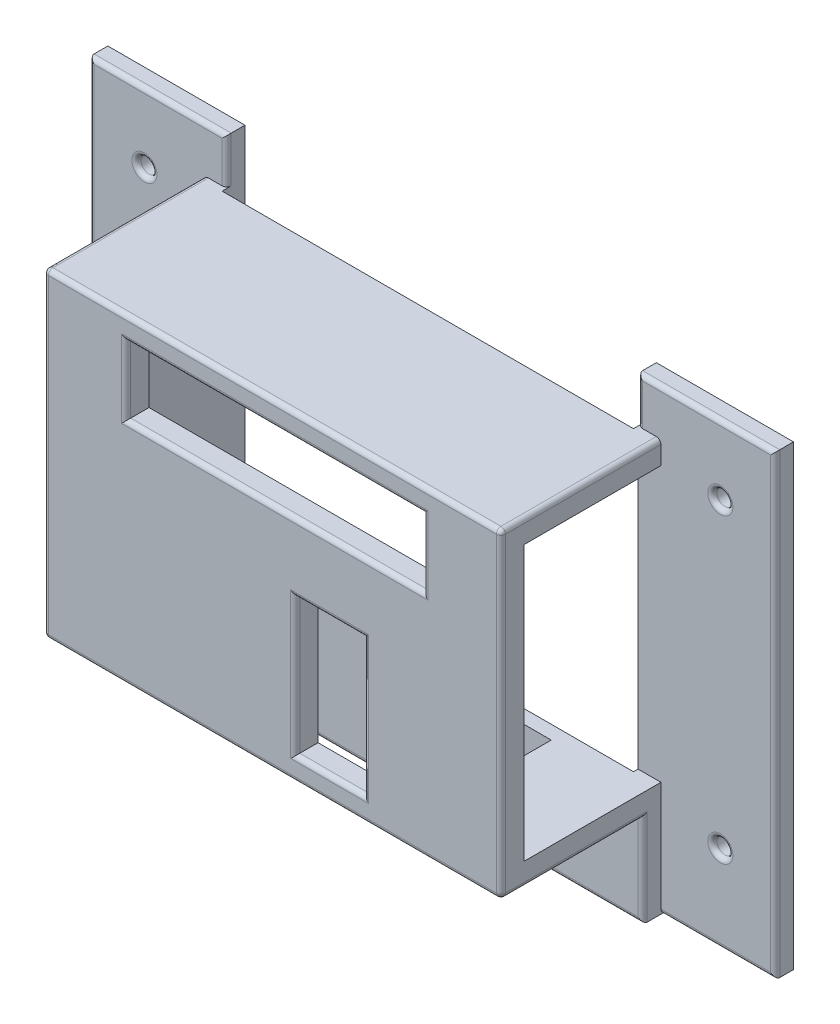
from build123d import *

# Parameters (mm, degrees)
SKETCH1_W           = 150
SKETCH1_H           = 100
BOSS_EXTRUDE1_DEPTH = 4
SKETCH2_W           = 100
SKETCH2_H           = 100
BOSS_EXTRUDE2_DEPTH = 35
SKETCH3_W           = 100
SKETCH3_H           = 31
CUT_EXTRUDE1_DEPTH  = 20
SKETCH4_W           = 100
SKETCH4_H           = 35
CUT_EXTRUDE2_DEPTH  = 10
SKETCH5_W           = 30
SKETCH5_H           = 60
CUT_EXTRUDE3_DEPTH  = 95
SKETCH6_W           = 90
SKETCH6_H           = 5
CUT_EXTRUDE4_DEPTH  = 185.447824601
SKETCH7_W           = 75
SKETCH7_H           = 26
CUT_EXTRUDE5_DEPTH  = 5
SKETCH8_W           = 65
SKETCH8_H           = 15
CUT_EXTRUDE6_DEPTH  = 5
SKETCH9_W           = 15
SKETCH9_H           = 30
CUT_EXTRUDE7_DEPTH  = 5
SKETCH10_R          = 1.75
CUT_EXTRUDE8_DEPTH  = 5
FILLET1_R           = 1
FILLET2_R           = 1
FILLET3_R           = 1
FILLET4_R           = 1
FILLET5_R           = 1


with BuildPart() as part:
    # Sketch1 → Boss-Extrude1 (new body)
    with BuildSketch(Plane.XY):
        with Locations((75, 50)):
            Rectangle(SKETCH1_W, SKETCH1_H)
    extrude(amount=BOSS_EXTRUDE1_DEPTH)

    # Sketch2 → Boss-Extrude2 (add)
    with BuildSketch(Plane.XY.offset(4)):
        with Locations((75, 50)):
            Rectangle(SKETCH2_W, SKETCH2_H)
    extrude(amount=BOSS_EXTRUDE2_DEPTH)

    # Sketch3 → Cut-Extrude1 (cut)
    with BuildSketch(Plane(origin=(0, 0, 0), x_dir=(-1, 0, 0), z_dir=(0, -1, 0))):
        with Locations((-75, -23.5)):
            Rectangle(SKETCH3_W, SKETCH3_H)
    extrude(amount=-CUT_EXTRUDE1_DEPTH, mode=Mode.SUBTRACT)

    # Sketch4 → Cut-Extrude2 (cut)
    with BuildSketch(Plane(origin=(0, 100, 0), x_dir=(1, 0, 0), z_dir=(0, 1, 0))):
        with Locations((75, -21.5)):
            Rectangle(SKETCH4_W, SKETCH4_H)
    extrude(amount=-CUT_EXTRUDE2_DEPTH, mode=Mode.SUBTRACT)

    # Sketch5 → Cut-Extrude3 (cut)
    with BuildSketch(Plane(origin=(125, 0, 0), x_dir=(0, 0, -1), z_dir=(1, 0, 0))):
        with Locations((-19, 55)):
            Rectangle(SKETCH5_W, SKETCH5_H)
    extrude(amount=-CUT_EXTRUDE3_DEPTH, mode=Mode.SUBTRACT)

    # Sketch6 → Cut-Extrude4 (cut, through all)
    with BuildSketch(Plane(origin=(0, 0, 0), x_dir=(-1, 0, 0), z_dir=(0, -1, 0))):
        with Locations((-75, -2.5)):
            Rectangle(SKETCH6_W, SKETCH6_H)
    extrude(amount=-CUT_EXTRUDE4_DEPTH, mode=Mode.SUBTRACT)

    # Sketch7 → Cut-Extrude5 (cut)
    with BuildSketch(Plane(origin=(0, 20, 0), x_dir=(-1, 0, 0), z_dir=(0, -1, 0))):
        with Locations((-67.5, -21)):
            Rectangle(SKETCH7_W, SKETCH7_H)
    extrude(amount=-CUT_EXTRUDE5_DEPTH, mode=Mode.SUBTRACT)

    # Sketch8 → Cut-Extrude6 (cut)
    with BuildSketch(Plane.XY.offset(39)):
        with Locations((75.5, 77.5)):
            Rectangle(SKETCH8_W, SKETCH8_H)
    extrude(amount=-CUT_EXTRUDE6_DEPTH, mode=Mode.SUBTRACT)

    # Sketch9 → Cut-Extrude7 (cut)
    with BuildSketch(Plane.XY.offset(39)):
        with Locations((87.5, 40)):
            Rectangle(SKETCH9_W, SKETCH9_H)
    extrude(amount=-CUT_EXTRUDE7_DEPTH, mode=Mode.SUBTRACT)

    # Sketch10 → Cut-Extrude8 (cut)
    with BuildSketch(Plane.XY.offset(4)):
        with Locations((12, 85)):
            Circle(SKETCH10_R)
        with Locations((12, 19)):
            Circle(SKETCH10_R)
        with Locations((138, 85)):
            Circle(SKETCH10_R)
        with Locations((138, 19)):
            Circle(SKETCH10_R)
    extrude(amount=-CUT_EXTRUDE8_DEPTH, mode=Mode.SUBTRACT)

    # Fillet1
    fillet1_edges = [part.edges().sort_by_distance(p)[0] for p in [
        (10.25, 19, 4),
        (136.25, 85, 4),
        (136.25, 19, 4),
        (10.25, 85, 4),
    ]]
    fillet(fillet1_edges, radius=FILLET1_R)

    # Fillet2
    fillet2_edges = [part.edges().sort_by_distance(p)[0] for p in [
        (43, 77.5, 39),
        (75.5, 70, 39),
        (108, 77.5, 39),
        (75.5, 85, 39),
        (80, 40, 39),
        (87.5, 25, 39),
        (95, 40, 39),
        (87.5, 55, 39),
        (125, 55, 39),
        (75, 20, 39),
        (25, 55, 39),
        (75, 90, 39),
    ]]
    fillet(fillet2_edges, radius=FILLET2_R)

    # Fillet3
    # the kernel refuses this fillet: 1 mm, written as the material it takes off along each edge
    with BuildSketch(Plane(origin=(26, 21, 38), x_dir=(0, -1, 0), z_dir=(-1, 0, 0))) as fillet3_piece_1_section:
        Polygon((0, 0), (FILLET3_R, 0), (FILLET3_R, FILLET3_R), (0, FILLET3_R), align=None)
    fillet3_piece_1 = extrude(amount=FILLET3_R, mode=Mode.PRIVATE)
    fillet3_piece_1 = fillet3_piece_1 - Plane(origin=(26, 21, 38), x_dir=(0, 0.7071067811865475, -0.7071067811865475), z_dir=(-1, 0, 0)) * Sphere(FILLET3_R, mode=Mode.PRIVATE)
    add(fillet3_piece_1, mode=Mode.SUBTRACT)
    with BuildSketch(Plane(origin=(26, 89, 38), x_dir=(-1, 0, 0), z_dir=(0, 1, 0))) as fillet3_piece_2_section:
        Polygon((0, 0), (FILLET3_R, 0), (FILLET3_R, FILLET3_R), (0, FILLET3_R), align=None)
    fillet3_piece_2 = extrude(amount=FILLET3_R, mode=Mode.PRIVATE)
    fillet3_piece_2 = fillet3_piece_2 - Plane(origin=(26, 89, 38), x_dir=(0.7071067811865475, 0, -0.7071067811865475), z_dir=(0, 1, 0)) * Sphere(FILLET3_R, mode=Mode.PRIVATE)
    add(fillet3_piece_2, mode=Mode.SUBTRACT)
    with BuildSketch(Plane(origin=(124, 21, 38), x_dir=(0, -1, 0), z_dir=(1, 0, 0))) as fillet3_piece_3_section:
        Polygon((0, 0), (FILLET3_R, 0), (FILLET3_R, -FILLET3_R), (0, -FILLET3_R), align=None)
    fillet3_piece_3 = extrude(amount=FILLET3_R, mode=Mode.PRIVATE)
    fillet3_piece_3 = fillet3_piece_3 - Plane(origin=(124, 21, 38), x_dir=(0, 0.7071067811865475, -0.7071067811865475), z_dir=(1, 0, 0)) * Sphere(FILLET3_R, mode=Mode.PRIVATE)
    add(fillet3_piece_3, mode=Mode.SUBTRACT)
    with BuildSketch(Plane(origin=(124, 89, 38), x_dir=(1, 0, 0), z_dir=(0, 1, 0))) as fillet3_piece_4_section:
        Polygon((0, 0), (FILLET3_R, 0), (FILLET3_R, -FILLET3_R), (0, -FILLET3_R), align=None)
    fillet3_piece_4 = extrude(amount=FILLET3_R, mode=Mode.PRIVATE)
    fillet3_piece_4 = fillet3_piece_4 - Plane(origin=(124, 89, 38), x_dir=(-0.7071067811865475, 0, -0.7071067811865475), z_dir=(0, 1, 0)) * Sphere(FILLET3_R, mode=Mode.PRIVATE)
    add(fillet3_piece_4, mode=Mode.SUBTRACT)
    with BuildSketch(Plane(origin=(125, 90, 38), x_dir=(-1, 0, 0), z_dir=(0, 0, -1)), Plane(origin=(25, 90, 4), x_dir=(1, 0, 0), z_dir=(0, 0, 1))) as fillet3_piece_5:
        with BuildLine():
            CenterArc((FILLET3_R, -FILLET3_R), FILLET3_R, 90, 90)
            Line((0, -FILLET3_R), (0, 0))
            Line((0, 0), (FILLET3_R, 0))
        make_face()
    extrude(amount=34, mode=Mode.SUBTRACT)
    with BuildSketch(Plane(origin=(25, 20, 8), x_dir=(0, 1, 0), z_dir=(0, 0, 1)), Plane(origin=(125, 20, 38), x_dir=(0, 1, 0), z_dir=(0, 0, -1))) as fillet3_piece_6:
        with BuildLine():
            CenterArc((FILLET3_R, -FILLET3_R), FILLET3_R, 90, 90)
            Line((0, -FILLET3_R), (0, 0))
            Line((0, 0), (FILLET3_R, 0))
        make_face()
    extrude(amount=30, mode=Mode.SUBTRACT)
    with BuildSketch(Plane(origin=(25, -2.5, 8), x_dir=(0, 0, -1), z_dir=(0, 1, 0))) as fillet3_piece_7:
        with BuildLine():
            CenterArc((FILLET3_R, -FILLET3_R), FILLET3_R, 90, 90)
            Line((0, -FILLET3_R), (0, 0))
            Line((0, 0), (FILLET3_R, 0))
        make_face()
    extrude(amount=22.5, mode=Mode.SUBTRACT)
    with BuildSketch(Plane(origin=(125, -2.5, 8), x_dir=(0, 0, -1), z_dir=(0, 1, 0))) as fillet3_piece_8:
        with BuildLine():
            CenterArc((FILLET3_R, FILLET3_R), FILLET3_R, 180, 90)
            Line((0, FILLET3_R), (0, 0))
            Line((0, 0), (FILLET3_R, 0))
        make_face()
    extrude(amount=22.5, mode=Mode.SUBTRACT)
    with BuildSketch(Plane(origin=(127.5, 0, 8), x_dir=(0, 1, 0), z_dir=(-1, 0, 0))) as fillet3_piece_9:
        with BuildLine():
            CenterArc((FILLET3_R, FILLET3_R), FILLET3_R, 180, 90)
            Line((0, FILLET3_R), (0, 0))
            Line((0, 0), (FILLET3_R, 0))
        make_face()
    extrude(amount=105, mode=Mode.SUBTRACT)
    with BuildSketch(Plane(origin=(25, 20, 5.5), x_dir=(0, 1, 0), z_dir=(0, 0, 1))) as fillet3_piece_10a_section:
        with BuildLine():
            CenterArc((FILLET3_R, -FILLET3_R), FILLET3_R, 90, 90)
            Line((0, -FILLET3_R), (0, 0))
            Line((0, 0), (FILLET3_R, 0))
        make_face()
    fillet3_piece_10a = extrude(amount=32.5, mode=Mode.PRIVATE)
    fillet3_piece_10a = split(fillet3_piece_10a, bisect_by=Plane(origin=(25.226395114, 20.226395114, 8), z_dir=(0, 0, -1)), keep=Keep.TOP, mode=Mode.PRIVATE)
    with BuildSketch(Plane(origin=(25, -2.5, 8), x_dir=(0, 0, -1), z_dir=(0, 1, 0))) as fillet3_piece_10b_section:
        with BuildLine():
            CenterArc((FILLET3_R, -FILLET3_R), FILLET3_R, 90, 90)
            Line((0, -FILLET3_R), (0, 0))
            Line((0, 0), (FILLET3_R, 0))
        make_face()
    fillet3_piece_10b = extrude(amount=25, mode=Mode.PRIVATE)
    fillet3_piece_10b = split(fillet3_piece_10b, bisect_by=Plane(origin=(25.226395114, 20, 7.773604886), z_dir=(0, 1, 0)), keep=Keep.TOP, mode=Mode.PRIVATE)
    fillet3_piece_10 = fillet3_piece_10a & fillet3_piece_10b
    add(fillet3_piece_10, mode=Mode.SUBTRACT)
    with BuildSketch(Plane(origin=(125, 20, 38), x_dir=(0, 1, 0), z_dir=(0, 0, -1))) as fillet3_piece_11a_section:
        with BuildLine():
            CenterArc((FILLET3_R, -FILLET3_R), FILLET3_R, 90, 90)
            Line((0, -FILLET3_R), (0, 0))
            Line((0, 0), (FILLET3_R, 0))
        make_face()
    fillet3_piece_11a = extrude(amount=32.5, mode=Mode.PRIVATE)
    fillet3_piece_11a = split(fillet3_piece_11a, bisect_by=Plane(origin=(124.773604886, 20.226395114, 8), z_dir=(0, 0, -1)), keep=Keep.TOP, mode=Mode.PRIVATE)
    with BuildSketch(Plane(origin=(125, -2.5, 8), x_dir=(0, 0, -1), z_dir=(0, 1, 0))) as fillet3_piece_11b_section:
        with BuildLine():
            CenterArc((FILLET3_R, FILLET3_R), FILLET3_R, 180, 90)
            Line((0, FILLET3_R), (0, 0))
            Line((0, 0), (FILLET3_R, 0))
        make_face()
    fillet3_piece_11b = extrude(amount=25, mode=Mode.PRIVATE)
    fillet3_piece_11b = split(fillet3_piece_11b, bisect_by=Plane(origin=(124.773604886, 20, 7.773604886), z_dir=(0, 1, 0)), keep=Keep.TOP, mode=Mode.PRIVATE)
    fillet3_piece_11 = fillet3_piece_11a & fillet3_piece_11b
    add(fillet3_piece_11, mode=Mode.SUBTRACT)

    # Fillet4
    fillet4_edges = [part.edges().sort_by_distance(p)[0] for p in [
        (12.5, 0, 4),
        (137.5, 0, 4),
        (0, 50, 4),
        (15, 100, 4),
        (135, 100, 4),
        (30, 95, 4),
        (120, 95, 4),
        (150, 50, 4),
    ]]
    fillet(fillet4_edges, radius=FILLET4_R)

    # Fillet5
    fillet5_edges = [part.edges().sort_by_distance(p)[0] for p in [
        (30, 20, 21),
        (105, 20, 21),
        (67.5, 20, 34),
    ]]
    fillet(fillet5_edges, radius=FILLET5_R)


solid = part.part
